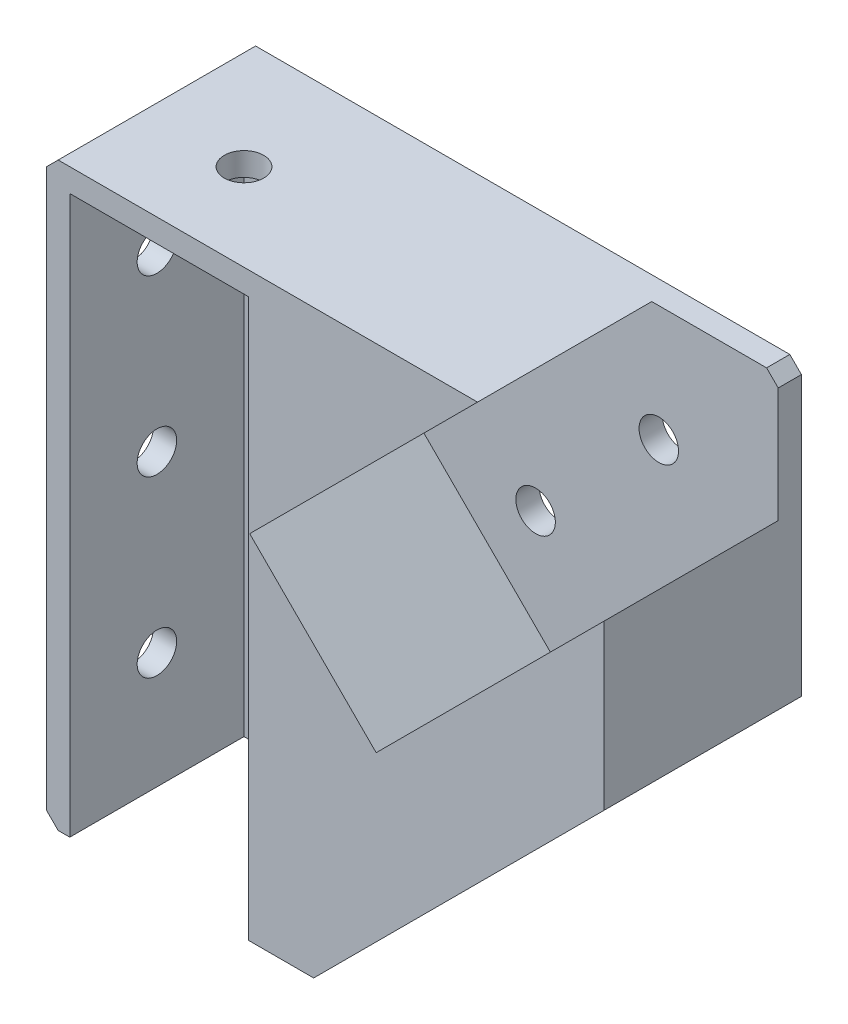
from build123d import *

# Parameters (mm, degrees)
SKETCH1_W                = 48
SKETCH1_H                = 48
BOSS_EXTRUDE1_DEPTH      = 2
SKETCH2_W                = 2
SKETCH2_H                = 48
BOSS_EXTRUDE2_DEPTH      = 15
SKETCH3_W                = 48
SKETCH3_H                = 17
BOSS_EXTRUDE3_DEPTH      = 2
SKETCH6_W                = 28.6
SKETCH6_H                = 48
BOSS_EXTRUDE4_DEPTH      = 15
CUT_EXTRUDE2_DEPTH       = 15
M3_CLEARANCE_HOLE1_D     = 3.4
CHAMFER1_SIZE            = 1
CHAMFER2_SIZE            = 1
CHAMFER3_SIZE            = 1
M3_CLEARANCE_HOLE2_D     = 3.4
CHAMFER7_SIZE            = 25
M3_CLEARANCE_HOLE3_D     = 3.4
M3_CLEARANCE_HOLE3_DEPTH = 2


# Read off the part's stored shape, not the designer's step: CBORE for M3 SBHCS1
with BuildPart() as part:
    # Sketch1 → Boss-Extrude1 (new body)
    with BuildSketch(Plane.XY):
        Rectangle(SKETCH1_W, SKETCH1_H)
    extrude(amount=BOSS_EXTRUDE1_DEPTH)

    # Sketch2 → Boss-Extrude2 (add)
    with BuildSketch(Plane.XY.offset(2)):
        with Locations((-23, 0)):
            Rectangle(SKETCH2_W, SKETCH2_H)
        with Locations((-5.6, 0)):
            Rectangle(SKETCH2_W, SKETCH2_H)
    extrude(amount=BOSS_EXTRUDE2_DEPTH)

    # Sketch3 → Boss-Extrude3 (add)
    with BuildSketch(Plane(origin=(0, 24, 0), x_dir=(1, 0, 0), z_dir=(0, 1, 0))):
        with Locations((0, -8.5)):
            Rectangle(SKETCH3_W, SKETCH3_H)
    extrude(amount=BOSS_EXTRUDE3_DEPTH)

    # Sketch6 → Boss-Extrude4 (add)
    with BuildSketch(Plane.XY.offset(2)):
        with Locations((9.7, 0)):
            Rectangle(SKETCH6_W, SKETCH6_H)
    extrude(amount=BOSS_EXTRUDE4_DEPTH)

    # Sketch7 → Cut-Extrude2 (cut)
    with BuildSketch(Plane.XY.offset(17)):
        Polygon((24, 15.11055557), (4.381531726, -4.507912705), (-6.507912705, 6.381531726), (13.11055557, 26), (24, 26), align=None)
    extrude(amount=-CUT_EXTRUDE2_DEPTH, mode=Mode.SUBTRACT)

    # M3 Clearance Hole1 (through all)
    with Locations(Plane.XY.offset(2)):
        with Locations((-14.5, 16), (-14.5, 1), (-14.5, -14), (3.11055557, 5.393398282), (13.717157288, 16)):
            Hole(M3_CLEARANCE_HOLE1_D / 2)

    # Chamfer1
    chamfer1_edges = [part.edges().sort_by_distance(p)[0] for p in [
        (24, 26, 1),
    ]]
    chamfer(chamfer1_edges, length=CHAMFER1_SIZE)

    # Chamfer2
    chamfer2_edges = [part.edges().sort_by_distance(p)[0] for p in [
        (-24, 26, 8.5),
    ]]
    chamfer(chamfer2_edges, length=CHAMFER2_SIZE)

    # Chamfer3
    chamfer3_edges = [part.edges().sort_by_distance(p)[0] for p in [
        (-24, -24, 8.5),
    ]]
    chamfer(chamfer3_edges, length=CHAMFER3_SIZE)

    # M3 Clearance Hole2 (through all)
    with Locations(Plane(origin=(0, 24, 0), x_dir=(-1, 0, 0), z_dir=(0, -1, 0))):
        with Locations((14.5, -9.5)):
            Hole(M3_CLEARANCE_HOLE2_D / 2)

    # Chamfer7
    chamfer7_edges = [part.edges().sort_by_distance(p)[0] for p in [
        (24, -24, 8.5),
    ]]
    chamfer(chamfer7_edges, length=CHAMFER7_SIZE)

    # CBORE for M3 SBHCS1 outline → CBORE for M3 SBHCS1 (revolve, cut)
    with BuildSketch(Plane(origin=(5.428932188, 5.428932188, 9.5), x_dir=(0.707106781186549, 0.707106781186546, 0), z_dir=(0, 0, -1))):
        Polygon((0, 6.285786438), (1.7, 6.285786438), (1.7, 8.613455967), (3.35, 8.613455967), (3.35, 14.940532299), (4.5, 16.263455967), (0, 16.263455967), align=None)
    revolve(axis=Axis((5.428932188, 5.428932188, 9.5), (0.707106781186546, -0.707106781186549, 0)), mode=Mode.SUBTRACT)

    # M3 Clearance Hole3
    with Locations(Plane.ZY.offset(24)):
        with Locations((9.5, -14), (9.5, 1), (9.5, 16)):
            Hole(M3_CLEARANCE_HOLE3_D / 2, depth=M3_CLEARANCE_HOLE3_DEPTH)


solid = part.part
